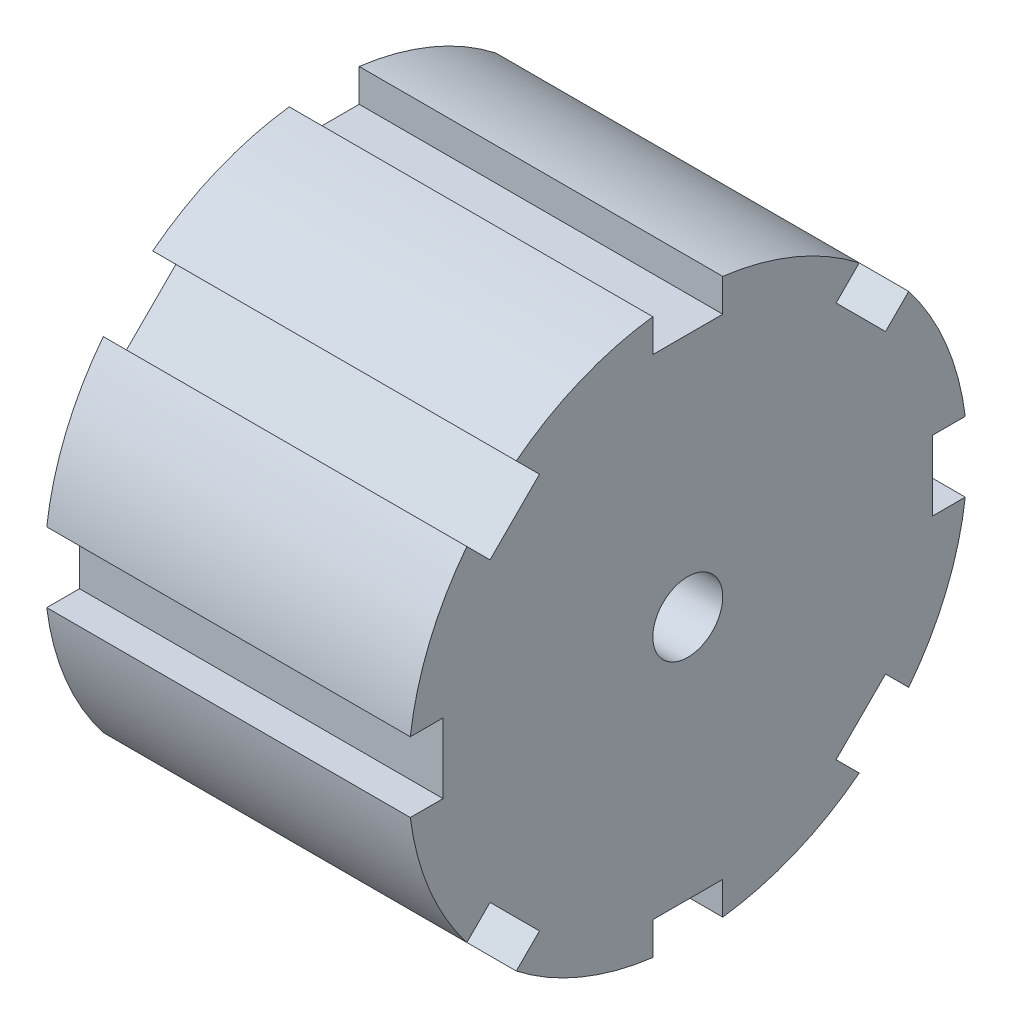
from build123d import *

# Parameters (mm, degrees)
SKETCH1_R           = 25.4
BOSS_EXTRUDE1_DEPTH = 33.02
SKETCH2_R           = 3.175
SKETCH2_W           = 6.35
SKETCH2_H           = 6.35
CUT_EXTRUDE1_DEPTH  = 109.22


with BuildPart() as part:
    # Sketch1 → Boss-Extrude1 (new body)
    with BuildSketch(Plane(origin=(0, 0, 0), x_dir=(0, 0, -1), z_dir=(1, 0, 0))):
        Circle(SKETCH1_R)
    extrude(amount=-BOSS_EXTRUDE1_DEPTH)

    # Sketch2 → Cut-Extrude1 (cut)
    with BuildSketch(Plane(origin=(0, 0, 0), x_dir=(0, 0, -1), z_dir=(1, 0, 0))):
        Circle(SKETCH2_R)
        Polygon((22.450640303, 17.960512242), (17.960512242, 22.450640303), (13.470384182, 17.960512242), (17.960512242, 13.470384182), align=None)
        with Locations((0, 25.4)):
            Rectangle(SKETCH2_W, SKETCH2_H)
        with Locations((25.4, 0)):
            Rectangle(SKETCH2_W, SKETCH2_H)
        Polygon((17.960512242, -22.450640303), (22.450640303, -17.960512242), (17.960512242, -13.470384182), (13.470384182, -17.960512242), align=None)
        with Locations((0, -25.4)):
            Rectangle(SKETCH2_W, SKETCH2_H)
        Polygon((-22.450640303, -17.960512242), (-17.960512242, -22.450640303), (-13.470384182, -17.960512242), (-17.960512242, -13.470384182), align=None)
        with Locations((-25.4, 0)):
            Rectangle(SKETCH2_W, SKETCH2_H)
        Polygon((-17.960512242, 22.450640303), (-22.450640303, 17.960512242), (-17.960512242, 13.470384182), (-13.470384182, 17.960512242), align=None)
    extrude(amount=-CUT_EXTRUDE1_DEPTH, mode=Mode.SUBTRACT)


solid = part.part
